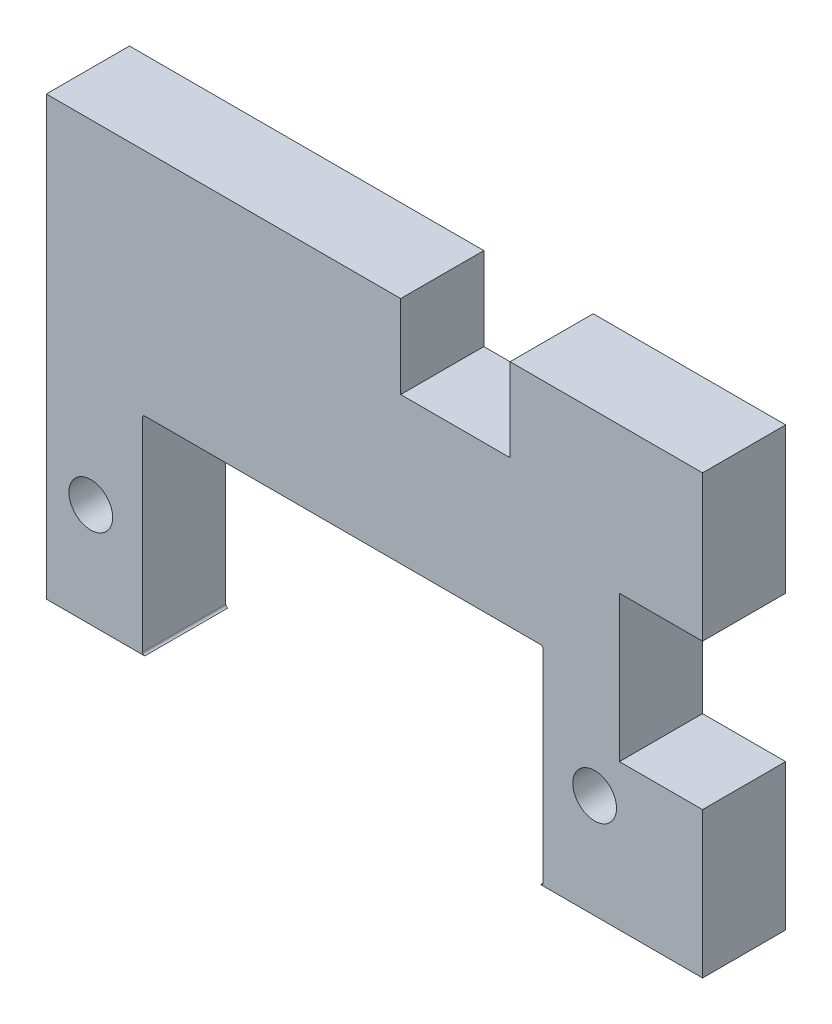
from build123d import *

# Parameters (mm, degrees)
SKETCH1_W           = 38.1
SKETCH1_H           = 25.4
BOSS_EXTRUDE1_DEPTH = 4.826
SKETCH2_W           = 4.826
SKETCH2_H           = 8.466666666
CUT_EXTRUDE1_DEPTH  = 47.044112284
SKETCH3_R           = 1.27
CUT_EXTRUDE2_DEPTH  = 47.044112284
CUT_EXTRUDE3_DEPTH  = 47.044112284
SKETCH5_W           = 6.35
SKETCH5_H           = 4.826
CUT_EXTRUDE4_DEPTH  = 47.044112284


with BuildPart() as part:
    # Sketch1 → Boss-Extrude1 (new body)
    with BuildSketch(Plane.XY):
        with Locations((19.05, 12.7)):
            Rectangle(SKETCH1_W, SKETCH1_H)
    extrude(amount=BOSS_EXTRUDE1_DEPTH)

    # Sketch2 → Cut-Extrude1 (cut, through all)
    with BuildSketch(Plane.XY.offset(4.826)):
        with Locations((35.687, 12.7)):
            Rectangle(SKETCH2_W, SKETCH2_H)
    extrude(amount=-CUT_EXTRUDE1_DEPTH, mode=Mode.SUBTRACT)

    # Sketch3 → Cut-Extrude2 (cut, through all)
    with BuildSketch(Plane.XY.offset(4.826)):
        with Locations((2.580480538, 6.0325)):
            Circle(SKETCH3_R)
        with Locations((31.836519462, 6.0325)):
            Circle(SKETCH3_R)
    extrude(amount=-CUT_EXTRUDE2_DEPTH, mode=Mode.SUBTRACT)

    # Sketch4 → Cut-Extrude3 (cut, through all)
    with BuildSketch(Plane(origin=(0, 0, 0), x_dir=(-1, 0, 0), z_dir=(0, 0, -1))):
        with BuildLine():
            Line((-28.702, 12.065), (-5.715, 12.065))
            ThreePointArc((-5.715, 12.065), (-5.625197439, 12.027802561), (-5.588, 11.938))
            Line((-5.588, 11.938), (-5.588, 0.127))
            ThreePointArc((-5.588, 0.127), (-5.625197439, 0.037197439), (-5.715, 0))
            Line((-5.715, 0), (-28.702, 0))
            ThreePointArc((-28.702, 0), (-28.791802561, 0.037197439), (-28.829, 0.127))
            Line((-28.829, 0.127), (-28.829, 11.938))
            ThreePointArc((-28.829, 11.938), (-28.791802561, 12.027802561), (-28.702, 12.065))
        make_face()
    extrude(amount=-CUT_EXTRUDE3_DEPTH, mode=Mode.SUBTRACT)

    # Sketch5 → Cut-Extrude4 (cut, through all)
    with BuildSketch(Plane.XY.offset(4.826)):
        with Locations((23.749, 22.987)):
            Rectangle(SKETCH5_W, SKETCH5_H)
    extrude(amount=-CUT_EXTRUDE4_DEPTH, mode=Mode.SUBTRACT)


solid = part.part
